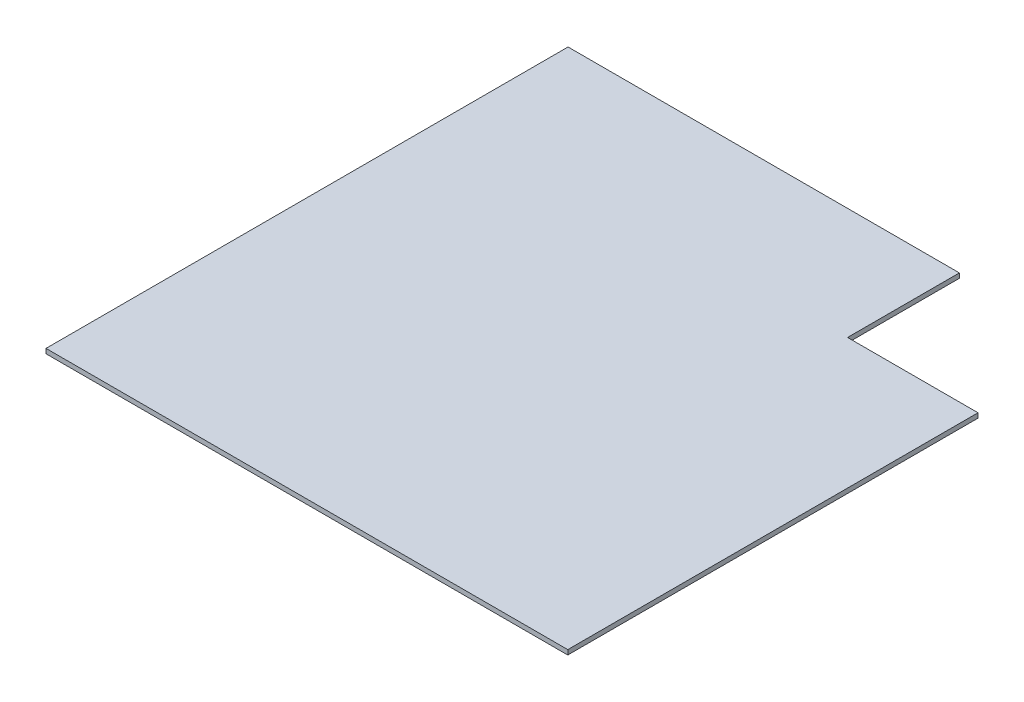
from build123d import *

# Parameters (mm, degrees)
BOSS_EXTRUDE1_DEPTH = 1.6002


with BuildPart() as part:
    # Sketch1 → Boss-Extrude1 (new body)
    with BuildSketch(Plane(origin=(0, 0, 0), x_dir=(1, 0, 0), z_dir=(0, 1, 0))):
        Polygon((167.828602808, 178.411267915), (167.828602808, 0.515267915), (345.628602808, 0.515267915), (345.628602808, 140.311267915), (301.178602808, 140.311267915), (301.178602808, 178.411267915), align=None)
    extrude(amount=BOSS_EXTRUDE1_DEPTH)


solid = part.part
